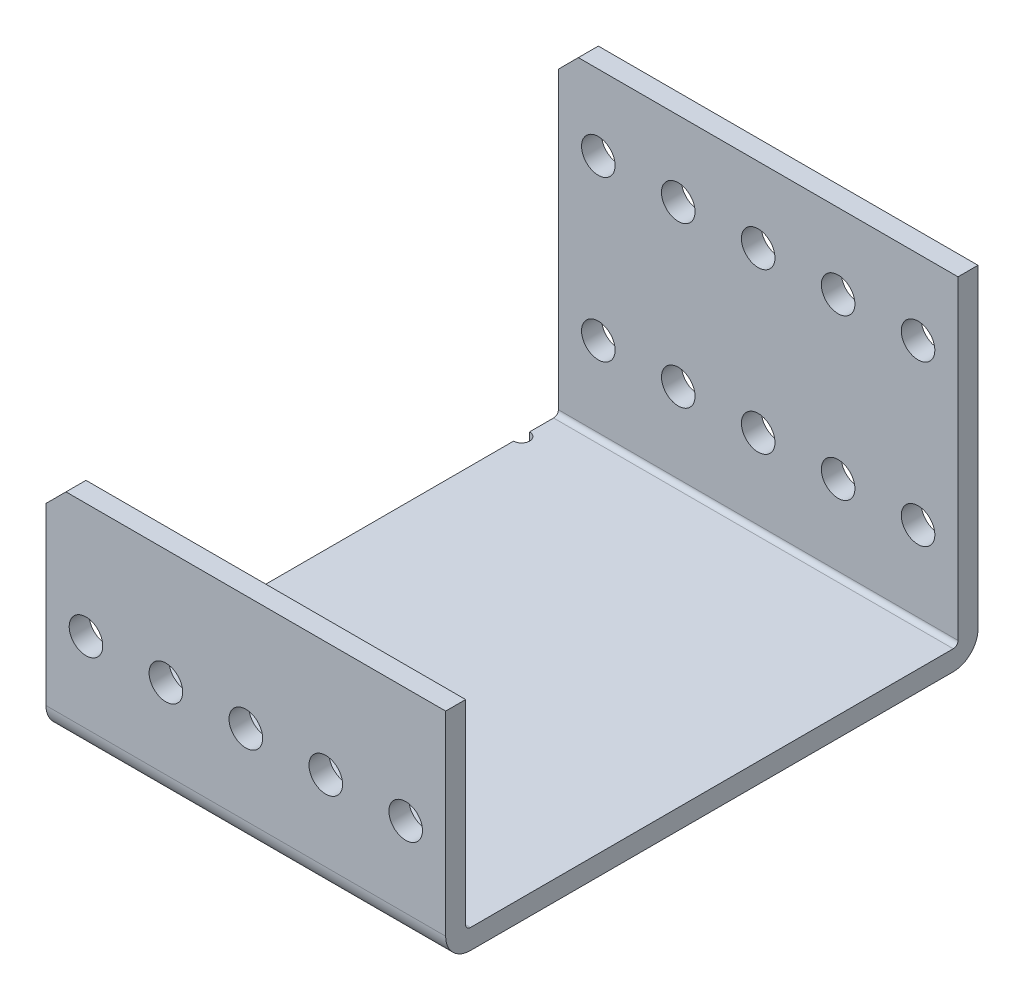
from build123d import *

# Parameters (mm, degrees)
SKETCH1_W            = 698.5
SKETCH1_H            = 84.582
BOSS_EXTRUDE1_DEPTH  = 34.925
SKETCH2_W            = 81.407
SKETCH2_H            = 31.75
CUT_EXTRUDE1_DEPTH   = 716.844146858
SKETCH3_W            = 698.5
SKETCH3_H            = 3.175
BOSS_EXTRUDE2_DEPTH  = 50.8
M2_CLEARANCE_HOLE1_D = 2.54
M5_CLEARANCE_HOLE1_D = 5.334
CHAMFER1_SIZE        = 3.175
FILLET1_R            = 0.762
FILLET2_R            = 3.937
SKETCH8_W            = 725.924928317
SKETCH8_H            = 218.216354959
CUT_EXTRUDE2_DEPTH   = 614.144311061


with BuildPart() as part:
    # Sketch1 → Boss-Extrude1 (new body)
    with BuildSketch(Plane(origin=(0, 57.816398039, 0), x_dir=(1, 0, 0), z_dir=(0, 1, 0))):
        with Locations((253.148031467, -103.269491579)):
            Rectangle(SKETCH1_W, SKETCH1_H)
    extrude(amount=-BOSS_EXTRUDE1_DEPTH)

    # Sketch2 → Cut-Extrude1 (cut, through all)
    with BuildSketch(Plane(origin=(602.398031467, 0, 0), x_dir=(0, 0, -1), z_dir=(1, 0, 0))):
        with Locations((-101.681991579, 41.941398039)):
            Rectangle(SKETCH2_W, SKETCH2_H)
    extrude(amount=-CUT_EXTRUDE1_DEPTH, mode=Mode.SUBTRACT)

    # Sketch3 → Boss-Extrude2 (add)
    with BuildSketch(Plane(origin=(0, 26.066398039, 0), x_dir=(-1, 0, 0), z_dir=(0, 1, 0))):
        with Locations((-253.148031467, 62.565991579)):
            Rectangle(SKETCH3_W, SKETCH3_H)
    extrude(amount=BOSS_EXTRUDE2_DEPTH)

    # M2 Clearance Hole1 (through all)
    with Locations(Plane(origin=(0, 26.066398039, 0), x_dir=(1, 0, 0), z_dir=(0, 1, 0))):
        with Locations((-96.101968533, -136.543491579), (-96.101968533, -69.995491579)):
            Hole(M2_CLEARANCE_HOLE1_D / 2)

    # M5 Clearance Hole1 (through all)
    with Locations(Plane(origin=(0, 0, 60.978491579), x_dir=(-1, 0, 0), z_dir=(0, 0, -1))):
        with Locations((-469.048031467, 64.928398039), (-481.748031467, 64.928398039), (-469.048031467, 39.528398039), (-481.748031467, 39.528398039), (-456.348031467, 39.528398039), (-443.648031467, 39.528398039), (-430.948031467, 39.528398039), (-418.248031467, 39.528398039), (-405.548031467, 39.528398039), (-392.848031467, 39.528398039), (-380.148031467, 39.528398039), (-367.448031467, 39.528398039), (-354.748031467, 39.528398039), (-342.048031467, 39.528398039), (-329.348031467, 39.528398039), (-316.648031467, 39.528398039), (-303.948031467, 39.528398039), (-291.248031467, 39.528398039), (-278.548031467, 39.528398039), (-265.848031467, 39.528398039), (-253.148031467, 39.528398039), (-240.448031467, 39.528398039), (-227.748031467, 39.528398039), (-215.048031467, 39.528398039), (-202.348031467, 39.528398039), (-189.648031467, 39.528398039), (-176.948031467, 39.528398039), (-164.248031467, 39.528398039), (-151.548031467, 39.528398039), (-138.848031467, 39.528398039), (-126.148031467, 39.528398039), (-113.448031467, 39.528398039), (-100.748031467, 39.528398039), (-88.048031467, 39.528398039), (-75.348031467, 39.528398039), (-62.648031467, 39.528398039), (-49.948031467, 39.528398039), (-37.248031467, 39.528398039), (-24.548031467, 39.528398039), (-11.848031467, 39.528398039), (0.851968533, 39.528398039), (13.551968533, 39.528398039), (26.251968533, 39.528398039), (38.951968533, 39.528398039), (51.651968533, 39.528398039), (64.351968533, 39.528398039), (77.051968533, 39.528398039), (89.751968533, 39.528398039), (-456.348031467, 64.928398039), (-443.648031467, 64.928398039), (-430.948031467, 64.928398039), (-418.248031467, 64.928398039), (-405.548031467, 64.928398039), (-392.848031467, 64.928398039), (-380.148031467, 64.928398039), (-367.448031467, 64.928398039), (-354.748031467, 64.928398039), (-342.048031467, 64.928398039), (-329.348031467, 64.928398039), (-316.648031467, 64.928398039), (-303.948031467, 64.928398039), (-291.248031467, 64.928398039), (-278.548031467, 64.928398039), (-265.848031467, 64.928398039), (-253.148031467, 64.928398039), (-240.448031467, 64.928398039), (-227.748031467, 64.928398039), (-215.048031467, 64.928398039), (-202.348031467, 64.928398039), (-189.648031467, 64.928398039), (-176.948031467, 64.928398039), (-164.248031467, 64.928398039), (-151.548031467, 64.928398039), (-138.848031467, 64.928398039), (-126.148031467, 64.928398039), (-113.448031467, 64.928398039), (-100.748031467, 64.928398039), (-88.048031467, 64.928398039), (-75.348031467, 64.928398039), (-62.648031467, 64.928398039), (-49.948031467, 64.928398039), (-37.248031467, 64.928398039), (-24.548031467, 64.928398039), (-11.848031467, 64.928398039), (0.851968533, 64.928398039), (13.551968533, 64.928398039), (26.251968533, 64.928398039), (38.951968533, 64.928398039), (51.651968533, 64.928398039), (64.351968533, 64.928398039), (77.051968533, 64.928398039), (89.751968533, 64.928398039), (-494.448031467, 64.928398039), (-494.448031467, 39.528398039), (-507.148031467, 64.928398039), (-507.148031467, 39.528398039), (-519.848031467, 64.928398039), (-519.848031467, 39.528398039), (-532.548031467, 64.928398039), (-532.548031467, 39.528398039), (-545.248031467, 64.928398039), (-545.248031467, 39.528398039), (-557.948031467, 64.928398039), (-557.948031467, 39.528398039), (-570.648031467, 64.928398039), (-570.648031467, 39.528398039), (-583.348031467, 64.928398039), (-583.348031467, 39.528398039), (-596.048031467, 64.928398039), (-596.048031467, 39.528398039)):
            Hole(M5_CLEARANCE_HOLE1_D / 2)

    # Chamfer1
    chamfer1_edges = [part.edges().sort_by_distance(p)[0] for p in [
        (602.398031467, 76.866398039, 62.565991579),
        (-96.101968533, 57.816398039, 143.972991579),
        (602.398031467, 57.816398039, 143.972991579),
        (-96.101968533, 76.866398039, 62.565991579),
    ]]
    chamfer(chamfer1_edges, length=CHAMFER1_SIZE)

    # Fillet1
    fillet1_edges = [part.edges().sort_by_distance(p)[0] for p in [
        (253.148031467, 26.066398039, 64.153491579),
        (253.148031467, 26.066398039, 142.385491579),
    ]]
    fillet(fillet1_edges, radius=FILLET1_R)

    # Fillet2
    fillet2_edges = [part.edges().sort_by_distance(p)[0] for p in [
        (253.148031467, 22.891398039, 145.560491579),
        (253.148031467, 22.891398039, 60.978491579),
    ]]
    fillet(fillet2_edges, radius=FILLET2_R)

    # Sketch8 → Cut-Extrude2 (cut, through all)
    with BuildSketch(Plane(origin=(0, 0, 60.978491579), x_dir=(-1, 0, 0), z_dir=(0, 0, -1))):
        with Locations((-330.360495626, 61.250645378)):
            Rectangle(SKETCH8_W, SKETCH8_H)
    extrude(amount=-CUT_EXTRUDE2_DEPTH, mode=Mode.SUBTRACT)


solid = part.part
